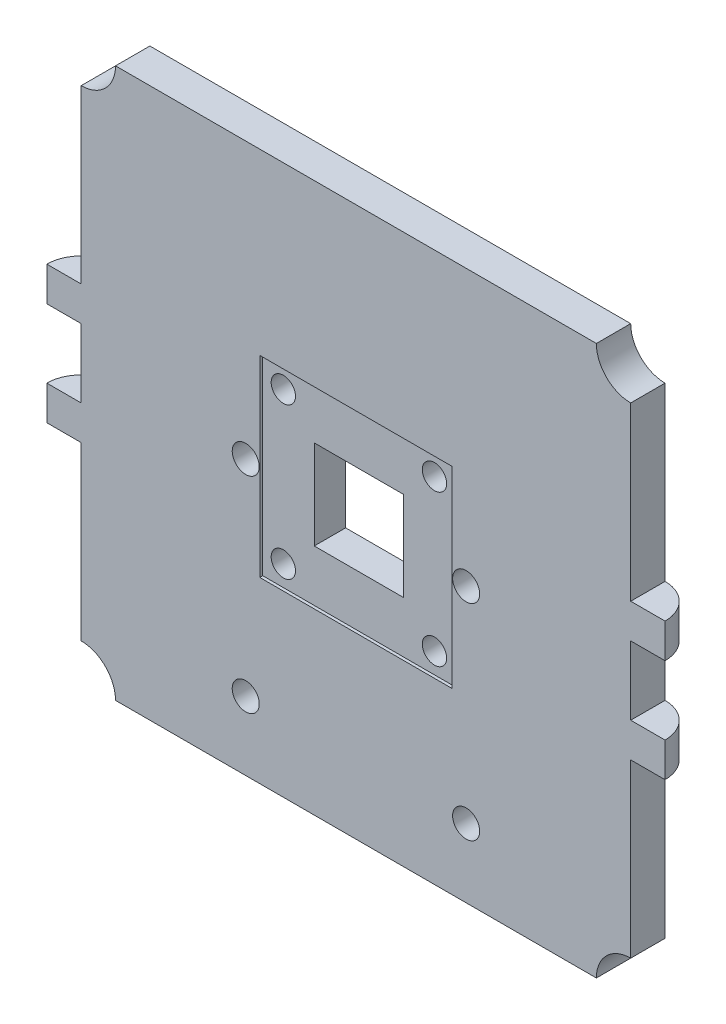
from build123d import *

# Parameters (mm, degrees)
SKETCH1_W                              = 114.3
SKETCH1_H                              = 114.3
BOSS_EXTRUDE1_DEPTH                    = 53.975
CUT_EXTRUDE1_DEPTH                     = 101.6
SKETCH5_W                              = 35.56
SKETCH5_H                              = 35.56
SKETCH5_W_2                            = 16.51
SKETCH5_H_2                            = 16.51
CUT_EXTRUDE5_DEPTH                     = 0.55
CUT_EXTRUDE6_REACH                     = 135.539
SKETCH5_3_W                            = 16.51
SKETCH5_3_H                            = 16.51
SKETCH13_R                             = 2.54
BOSS_EXTRUDE2_DEPTH                    = 1.27
CUT_EXTRUDE7_DEPTH                     = 2.54
CUT_EXTRUDE8_DEPTH                     = 0.635
CUT_EXTRUDE9_DEPTH                     = 1.27
CBORE_FOR_M5_HEX_HEAD_BOLT2_AT_2_COUNT = 2
CBORE_FOR_M5_HEX_HEAD_BOLT2_AT_2_PITCH = 27.94
CBORE_FOR_M5_HEX_HEAD_BOLT2_AT_3_COUNT = 2
CBORE_FOR_M5_HEX_HEAD_BOLT2_AT_3_PITCH = 39.513126933
CBORE_FOR_M5_HEX_HEAD_BOLT2_AT_4_COUNT = 2
CBORE_FOR_M5_HEX_HEAD_BOLT2_AT_4_PITCH = 27.94
CIRPATTERN1_COUNT                      = 4
SKETCH26_W                             = 114.3
SKETCH26_H                             = 107.95
CUT_EXTRUDE11_DEPTH                    = 107.95
CUT_EXTRUDE12_REACH                    = 80.865
SKETCH27_R                             = 2.5
SKETCH29_W                             = 6.35
SKETCH29_H                             = 12.7
CUT_EXTRUDE13_DEPTH                    = 6.35
FILLET1_R                              = 6.35
SKETCH30_R                             = 2.38125
CUT_EXTRUDE14_DEPTH                    = 4.7625


with BuildPart() as part:
    # Sketch1 → Boss-Extrude1 (new, symmetric)
    with BuildSketch(Plane(origin=(0, 0, 0), x_dir=(1, 0, 0), z_dir=(0, 1, 0))):
        Rectangle(SKETCH1_W, SKETCH1_H)
    extrude(amount=BOSS_EXTRUDE1_DEPTH, both=True)

    # Sketch2 → Cut-Extrude1 (cut)
    with BuildSketch(Plane(origin=(0, 53.975, 0), x_dir=(1, 0, 0), z_dir=(0, 1, 0))):
        with BuildLine():
            Line((44.45, 50.8), (-44.45, 50.8))
            ThreePointArc((-44.45, 50.8), (-46.309871939, 46.309871939), (-50.8, 44.45))
            Line((-50.8, 44.45), (-50.8, -44.45))
            ThreePointArc((-50.8, -44.45), (-46.309871939, -46.309871939), (-44.45, -50.8))
            Line((-44.45, -50.8), (44.45, -50.8))
            ThreePointArc((44.45, -50.8), (46.309871939, -46.309871939), (50.8, -44.45))
            Line((50.8, -44.45), (50.8, 44.45))
            ThreePointArc((50.8, 44.45), (46.309871939, 46.309871939), (44.45, 50.8))
        make_face()
    extrude(amount=-CUT_EXTRUDE1_DEPTH, mode=Mode.SUBTRACT)

    # Sketch5 → Cut-Extrude5 (cut)
    with BuildSketch(Plane.XY.offset(-50.8)):
        with Locations((0, 3.175)):
            Rectangle(SKETCH5_W, SKETCH5_H)
        with Locations((0, 3.175)):
            Rectangle(SKETCH5_W_2, SKETCH5_H_2, mode=Mode.SUBTRACT)
    extrude(amount=-CUT_EXTRUDE5_DEPTH, mode=Mode.SUBTRACT)

    # Sketch5<3> → Cut-Extrude6 (cut, up to next)
    with BuildSketch(Plane.XY.offset(-50.8), mode=Mode.PRIVATE) as cut_extrude6_sk1:
        with Locations((0, 3.175)):
            Rectangle(SKETCH5_3_W, SKETCH5_3_H)
    cut_extrude6_tool1 = extrude(cut_extrude6_sk1.sketch, amount=-CUT_EXTRUDE6_REACH, mode=Mode.PRIVATE) & part.part
    add(cut_extrude6_tool1.solids().sort_by_distance((0, 3.175, -50.8))[0], mode=Mode.SUBTRACT)

    # Sketch13 → Boss-Extrude2 (add)
    with BuildSketch(Plane(origin=(0, 0, -57.15), x_dir=(-1, 0, 0), z_dir=(0, 0, -1))):
        with Locations(Location((-14.2875, 25.4, 0), (0, 0, 180))):
            Circle(SKETCH13_R)
    boss_extrude2 = extrude(amount=BOSS_EXTRUDE2_DEPTH)

    # Sketch14 → Revolve1 (revolve)
    with BuildSketch(Plane(origin=(14.2875, 25.4, -57.15), x_dir=(-1, 0, 0), z_dir=(0, -1, 0)), mode=Mode.PRIVATE) as revolve1_sk:
        with BuildLine():
            Line((0, 1.27), (0, 2.54))
            Line((0, 2.54), (2.286, 2.54))
            Line((2.286, 2.54), (2.64, 1.651))
            Line((2.64, 1.651), (2.64, 1.397))
            ThreePointArc((2.64, 1.397), (2.611999367, 1.316177664), (2.54, 1.27))
            Line((2.54, 1.27), (0, 1.27))
        make_face()
    revolve1 = revolve(revolve1_sk.sketch.rotate(Axis((14.2875, 25.4, -58.42), (0, 0, -1)), 180), axis=Axis((14.2875, 25.4, -58.42), (0, 0, -1)))

    # Sketch13<4> → Cut-Extrude7 (cut)
    with BuildSketch(Plane(origin=(0, 0, -57.15), x_dir=(-1, 0, 0), z_dir=(0, 0, -1))):
        with BuildLine():
            Line((16.083551224, 27.196051224), (14.7875, 25.9))
            Line((14.7875, 25.9), (14.7875, 24.9))
            Line((14.7875, 24.9), (16.083551224, 23.603948776))
            ThreePointArc((16.083551224, 23.603948776), (16.634154013, 24.427984082), (16.8275, 25.4))
            ThreePointArc((16.8275, 25.4), (16.634154013, 26.372015918), (16.083551224, 27.196051224))
        make_face()
        with BuildLine():
            Line((16.083551224, 23.603948776), (14.7875, 24.9))
            Line((14.7875, 24.9), (14.7875, 22.909698813))
            ThreePointArc((14.7875, 22.909698813), (15.486857561, 23.160995435), (16.083551224, 23.603948776))
        make_face()
        with BuildLine():
            ThreePointArc((14.7875, 27.890301187), (14.2875, 27.94), (13.7875, 27.890301187))
            Line((13.7875, 27.890301187), (13.7875, 25.9))
            Line((13.7875, 25.9), (14.2875, 25.4))
            Line((14.2875, 25.4), (14.7875, 25.9))
            Line((14.7875, 25.9), (14.7875, 27.890301187))
        make_face()
        with BuildLine():
            Line((14.2875, 25.4), (13.7875, 24.9))
            Line((13.7875, 24.9), (13.7875, 22.909698813))
            ThreePointArc((13.7875, 22.909698813), (14.2875, 22.86), (14.7875, 22.909698813))
            Line((14.7875, 22.909698813), (14.7875, 24.9))
            Line((14.7875, 24.9), (14.2875, 25.4))
        make_face()
        with BuildLine():
            ThreePointArc((16.083551224, 27.196051224), (15.486857561, 27.639004565), (14.7875, 27.890301187))
            Line((14.7875, 27.890301187), (14.7875, 25.9))
            Line((14.7875, 25.9), (16.083551224, 27.196051224))
        make_face()
        Polygon((14.7875, 25.9), (14.2875, 25.4), (14.7875, 24.9), align=None)
        Polygon((14.2875, 25.4), (13.7875, 25.9), (13.7875, 24.9), align=None)
        with BuildLine():
            Line((13.7875, 24.9), (13.7875, 25.9))
            Line((13.7875, 25.9), (12.491448776, 27.196051224))
            ThreePointArc((12.491448776, 27.196051224), (11.7475, 25.4), (12.491448776, 23.603948776))
            Line((12.491448776, 23.603948776), (13.7875, 24.9))
        make_face()
        with BuildLine():
            Line((13.7875, 22.909698813), (13.7875, 24.9))
            Line((13.7875, 24.9), (12.491448776, 23.603948776))
            ThreePointArc((12.491448776, 23.603948776), (13.088142439, 23.160995435), (13.7875, 22.909698813))
        make_face()
        with BuildLine():
            Line((13.7875, 25.9), (13.7875, 27.890301187))
            ThreePointArc((13.7875, 27.890301187), (13.088142439, 27.639004565), (12.491448776, 27.196051224))
            Line((12.491448776, 27.196051224), (13.7875, 25.9))
        make_face()
    cut_extrude7 = extrude(amount=-CUT_EXTRUDE7_DEPTH, mode=Mode.SUBTRACT)

    # Sketch13<5> → Cut-Extrude8 (cut)
    with BuildSketch(Plane(origin=(0, 0, -57.15), x_dir=(-1, 0, 0), z_dir=(0, 0, -1))):
        with BuildLine():
            Line((12.491448776, 23.603948776), (11.593423164, 22.705923164))
            ThreePointArc((11.593423164, 22.705923164), (12.601161082, 21.983516274), (13.7875, 21.622950887))
            Line((13.7875, 21.622950887), (13.7875, 22.909698813))
            ThreePointArc((13.7875, 22.909698813), (13.088142439, 23.160995435), (12.491448776, 23.603948776))
        make_face()
        with BuildLine():
            ThreePointArc((14.7875, 21.622950887), (15.973838918, 21.983516274), (16.981576836, 22.705923164))
            Line((16.981576836, 22.705923164), (16.083551224, 23.603948776))
            ThreePointArc((16.083551224, 23.603948776), (15.486857561, 23.160995435), (14.7875, 22.909698813))
            Line((14.7875, 22.909698813), (14.7875, 21.622950887))
        make_face()
        with BuildLine():
            ThreePointArc((16.981576836, 28.094076836), (15.973838918, 28.816483726), (14.7875, 29.177049113))
            Line((14.7875, 29.177049113), (14.7875, 27.890301187))
            ThreePointArc((14.7875, 27.890301187), (15.486857561, 27.639004565), (16.083551224, 27.196051224))
            Line((16.083551224, 27.196051224), (16.981576836, 28.094076836))
        make_face()
        with BuildLine():
            Line((13.7875, 27.890301187), (13.7875, 29.177049113))
            ThreePointArc((13.7875, 29.177049113), (12.601161082, 28.816483726), (11.593423164, 28.094076836))
            Line((11.593423164, 28.094076836), (12.491448776, 27.196051224))
            ThreePointArc((12.491448776, 27.196051224), (13.088142439, 27.639004565), (13.7875, 27.890301187))
        make_face()
    cut_extrude8 = extrude(amount=-CUT_EXTRUDE8_DEPTH, mode=Mode.SUBTRACT)

    # Sketch13<6> → Cut-Extrude9 (cut)
    with BuildSketch(Plane(origin=(0, 0, -57.15), x_dir=(-1, 0, 0), z_dir=(0, 0, -1))):
        with BuildLine():
            ThreePointArc((14.7875, 29.177049113), (14.2875, 29.21), (13.7875, 29.177049113))
            Line((13.7875, 29.177049113), (13.7875, 27.890301187))
            ThreePointArc((13.7875, 27.890301187), (14.2875, 27.94), (14.7875, 27.890301187))
            Line((14.7875, 27.890301187), (14.7875, 29.177049113))
        make_face()
        with BuildLine():
            Line((13.7875, 22.909698813), (13.7875, 21.622950887))
            ThreePointArc((13.7875, 21.622950887), (14.2875, 21.59), (14.7875, 21.622950887))
            Line((14.7875, 21.622950887), (14.7875, 22.909698813))
            ThreePointArc((14.7875, 22.909698813), (14.2875, 22.86), (13.7875, 22.909698813))
        make_face()
    cut_extrude9 = extrude(amount=-CUT_EXTRUDE9_DEPTH, mode=Mode.SUBTRACT)

    # Sketch17 → Cut-Revolve1 (revolve, cut)
    with BuildSketch(Plane(origin=(-14.2875, 25.4, -57.15), x_dir=(-1, 0, 0), z_dir=(0, -1, 0))):
        Polygon((0, -1.27), (0, -2.54), (2.286, -2.54), (2.64, -1.651), (2.64, -1.27), (2.54, -1.27), align=None)
    cut_revolve1 = revolve(axis=Axis((-14.2875, 25.4, -55.88), (0, 0, 1)), mode=Mode.SUBTRACT)

    # Sketch21 → CBORE for M5 Hex Head Bolt2 (revolve, cut)
    with BuildSketch(Plane(origin=(13.97, 17.145, -57.15), x_dir=(0, 1, 0), z_dir=(1, 0, 0))):
        Polygon((0, 0), (0, 18.288), (2.75, 16.635633298), (2.75, 5.8), (2.25, 5.8), (2.25, 0), align=None)
    cbore_for_m5_hex_head_bolt2 = revolve(axis=Axis((13.97, 17.145, -63.5), (0, 0, 1)), mode=Mode.SUBTRACT)

    # CBORE for M5 Hex Head Bolt2 at 2: CBORE for M5 Hex Head Bolt2 ×2
    with Locations(*[(-i * CBORE_FOR_M5_HEX_HEAD_BOLT2_AT_2_PITCH, 0, 0) for i in range(1, CBORE_FOR_M5_HEX_HEAD_BOLT2_AT_2_COUNT)]):
        add(cbore_for_m5_hex_head_bolt2, mode=Mode.SUBTRACT)

    # CBORE for M5 Hex Head Bolt2 at 3: CBORE for M5 Hex Head Bolt2 ×2
    with Locations(*[Vector(-0.7071067811865476, -0.7071067811865476, 0) * (i * CBORE_FOR_M5_HEX_HEAD_BOLT2_AT_3_PITCH) for i in range(1, CBORE_FOR_M5_HEX_HEAD_BOLT2_AT_3_COUNT)]):
        add(cbore_for_m5_hex_head_bolt2, mode=Mode.SUBTRACT)

    # CBORE for M5 Hex Head Bolt2 at 4: CBORE for M5 Hex Head Bolt2 ×2
    with Locations(*[(0, -i * CBORE_FOR_M5_HEX_HEAD_BOLT2_AT_4_PITCH, 0) for i in range(1, CBORE_FOR_M5_HEX_HEAD_BOLT2_AT_4_COUNT)]):
        add(cbore_for_m5_hex_head_bolt2, mode=Mode.SUBTRACT)

    # CirPattern1: Boss-Extrude2, Revolve1, Cut-Extrude7, Cut-Extrude8, Cut-Extrude9, Cut-Revolve1 ×4 about axis
    cirpattern1_axis = Axis((0, 3.175, 0), (0, 0, 1))
    add([boss_extrude2.rotate(cirpattern1_axis, i * 360 / CIRPATTERN1_COUNT) for i in range(1, CIRPATTERN1_COUNT)])
    add([revolve1.rotate(cirpattern1_axis, i * 360 / CIRPATTERN1_COUNT) for i in range(1, CIRPATTERN1_COUNT)])
    add([cut_extrude7.rotate(cirpattern1_axis, i * 360 / CIRPATTERN1_COUNT) for i in range(1, CIRPATTERN1_COUNT)], mode=Mode.SUBTRACT)
    add([cut_extrude8.rotate(cirpattern1_axis, i * 360 / CIRPATTERN1_COUNT) for i in range(1, CIRPATTERN1_COUNT)], mode=Mode.SUBTRACT)
    add([cut_extrude9.rotate(cirpattern1_axis, i * 360 / CIRPATTERN1_COUNT) for i in range(1, CIRPATTERN1_COUNT)], mode=Mode.SUBTRACT)
    add([cut_revolve1.rotate(cirpattern1_axis, i * 360 / CIRPATTERN1_COUNT) for i in range(1, CIRPATTERN1_COUNT)], mode=Mode.SUBTRACT)

    # Sketch26 → Cut-Extrude11 (cut)
    with BuildSketch(Plane.XY.offset(57.15)):
        Rectangle(SKETCH26_W, SKETCH26_H)
    extrude(amount=-CUT_EXTRUDE11_DEPTH, mode=Mode.SUBTRACT)

    # Sketch27 → Cut-Extrude12 (cut, up to next)
    with BuildSketch(Plane(origin=(0, 0, -57.15), x_dir=(-1, 0, 0), z_dir=(0, 0, -1)), mode=Mode.PRIVATE) as cut_extrude12_sk1:
        with Locations((-20.375, 3.075)):
            Circle(SKETCH27_R)
    cut_extrude12_tool1 = extrude(cut_extrude12_sk1.sketch, amount=-CUT_EXTRUDE12_REACH, mode=Mode.PRIVATE) & part.part
    # Sketch27 → Cut-Extrude12 (cut, up to next)
    with BuildSketch(Plane(origin=(0, 0, -57.15), x_dir=(-1, 0, 0), z_dir=(0, 0, -1)), mode=Mode.PRIVATE) as cut_extrude12_sk2:
        with Locations((20.375, 3.075)):
            Circle(SKETCH27_R)
    cut_extrude12_tool2 = extrude(cut_extrude12_sk2.sketch, amount=-CUT_EXTRUDE12_REACH, mode=Mode.PRIVATE) & part.part
    # Sketch27 → Cut-Extrude12 (cut, up to next)
    with BuildSketch(Plane(origin=(0, 0, -57.15), x_dir=(-1, 0, 0), z_dir=(0, 0, -1)), mode=Mode.PRIVATE) as cut_extrude12_sk3:
        with Locations((20.375, -34.925)):
            Circle(SKETCH27_R)
    cut_extrude12_tool3 = extrude(cut_extrude12_sk3.sketch, amount=-CUT_EXTRUDE12_REACH, mode=Mode.PRIVATE) & part.part
    # Sketch27 → Cut-Extrude12 (cut, up to next)
    with BuildSketch(Plane(origin=(0, 0, -57.15), x_dir=(-1, 0, 0), z_dir=(0, 0, -1)), mode=Mode.PRIVATE) as cut_extrude12_sk4:
        with Locations((-20.375, -34.925)):
            Circle(SKETCH27_R)
    cut_extrude12_tool4 = extrude(cut_extrude12_sk4.sketch, amount=-CUT_EXTRUDE12_REACH, mode=Mode.PRIVATE) & part.part
    add(cut_extrude12_tool1.solids().sort_by_distance((20.375, 3.075, -57.15))[0], mode=Mode.SUBTRACT)
    add(cut_extrude12_tool2.solids().sort_by_distance((-20.375, 3.075, -57.15))[0], mode=Mode.SUBTRACT)
    add(cut_extrude12_tool3.solids().sort_by_distance((-20.375, -34.925, -57.15))[0], mode=Mode.SUBTRACT)
    add(cut_extrude12_tool4.solids().sort_by_distance((20.375, -34.925, -57.15))[0], mode=Mode.SUBTRACT)

    # Sketch29 → Cut-Extrude13 (cut)
    with BuildSketch(Plane(origin=(0, 0, -57.15), x_dir=(-1, 0, 0), z_dir=(0, 0, -1))):
        with BuildLine():
            Line((-44.45, 53.975), (-57.15, 53.975))
            Line((-57.15, 53.975), (-57.15, 15.875))
            Line((-57.15, 15.875), (-50.8, 15.875))
            Line((-50.8, 15.875), (-50.8, 47.625))
            ThreePointArc((-50.8, 47.625), (-46.309871939, 49.484871939), (-44.45, 53.975))
        make_face()
        with BuildLine():
            ThreePointArc((44.45, 53.975), (46.309871939, 49.484871939), (50.8, 47.625))
            Line((50.8, 47.625), (50.8, 15.875))
            Line((50.8, 15.875), (57.15, 15.875))
            Line((57.15, 15.875), (57.15, 53.975))
            Line((57.15, 53.975), (44.45, 53.975))
        make_face()
        with Locations((-53.975, 3.175)):
            Rectangle(SKETCH29_W, SKETCH29_H)
        with Locations((53.975, 3.175)):
            Rectangle(SKETCH29_W, SKETCH29_H)
        with BuildLine():
            Line((-50.8, -41.275), (-50.8, -9.525))
            Line((-50.8, -9.525), (-57.15, -9.525))
            Line((-57.15, -9.525), (-57.15, -53.975))
            Line((-57.15, -53.975), (57.15, -53.975))
            Line((57.15, -53.975), (57.15, -9.525))
            Line((57.15, -9.525), (50.8, -9.525))
            Line((50.8, -9.525), (50.8, -41.275))
            ThreePointArc((50.8, -41.275), (46.309871939, -43.134871939), (44.45, -47.625))
            Line((44.45, -47.625), (-44.45, -47.625))
            ThreePointArc((-44.45, -47.625), (-46.309871939, -43.134871939), (-50.8, -41.275))
        make_face()
    extrude(amount=-CUT_EXTRUDE13_DEPTH, mode=Mode.SUBTRACT)

    # Fillet1
    fillet1_edges = [part.edges().sort_by_distance(p)[0] for p in [
        (57.15, 12.7, -57.15),
        (57.15, -6.35, -57.15),
        (-57.15, -6.35, -57.15),
        (-57.15, 12.7, -57.15),
    ]]
    fillet(fillet1_edges, radius=FILLET1_R - 0.0001)  # a hair under: the kernel refuses the full size

    # Sketch30 → Cut-Extrude14 (cut)
    with BuildSketch(Plane(origin=(0, 0, -57.15), x_dir=(-1, 0, 0), z_dir=(0, 0, -1))):
        with Locations((-34.925, 38.1)):
            Circle(SKETCH30_R)
        with Locations((34.925, 38.1)):
            Circle(SKETCH30_R)
        with Locations((34.925, -31.75)):
            Circle(SKETCH30_R)
        with Locations((-34.925, -31.75)):
            Circle(SKETCH30_R)
    extrude(amount=-CUT_EXTRUDE14_DEPTH, mode=Mode.SUBTRACT)


solid = part.part
